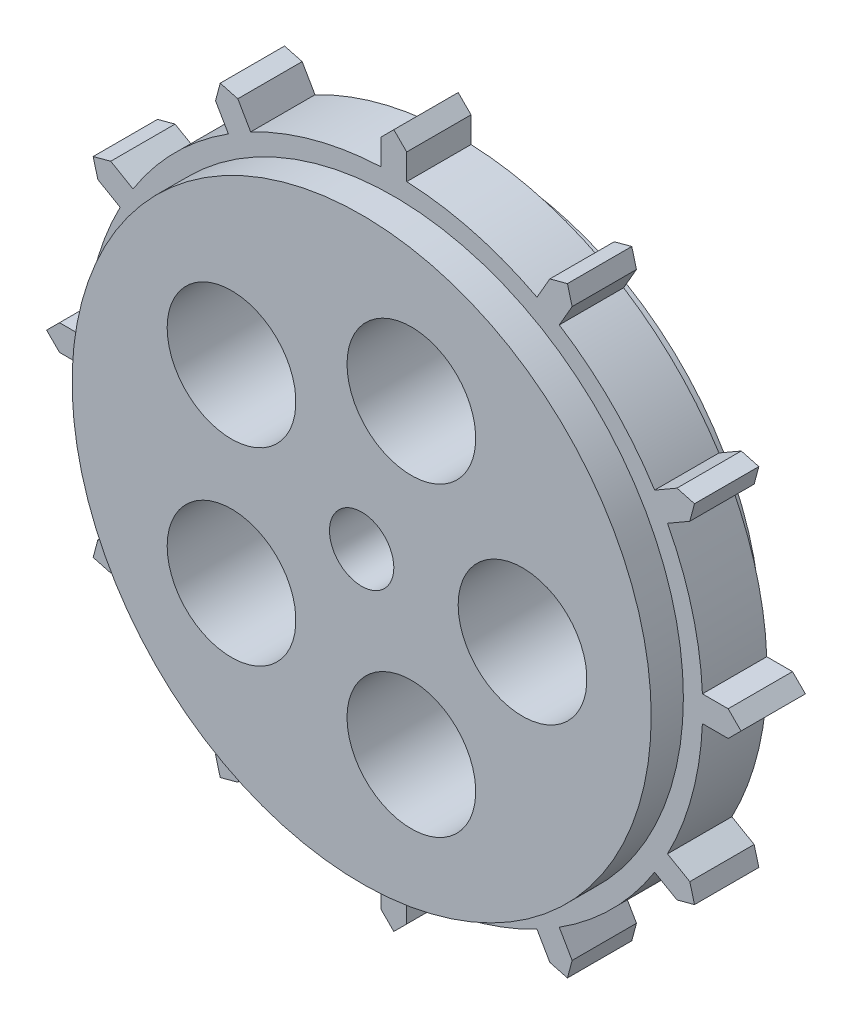
from build123d import *

# Parameters (mm, degrees)
BOSS_EXTRUDE1_DEPTH      = 2.5
BOSS_EXTRUDE1_DEPTH_BACK = 2.5
SKETCH3_R                = 21
BOSS_EXTRUDE2_DEPTH      = 2.5
SKETCH4_R                = 22.5
BOSS_EXTRUDE3_DEPTH      = 2.5
SKETCH5_R                = 2.5
CUT_EXTRUDE1_DEPTH       = 50
SKETCH6_R                = 5
CUT_EXTRUDE2_DEPTH       = 10


with BuildPart() as part:
    # Sketch1 → Boss-Extrude1 (new, two sides: drawn at the far end of the back side and taken through both)
    with BuildSketch(Plane.XY.offset(-BOSS_EXTRUDE1_DEPTH_BACK)):
        with BuildLine():
            Line((-1, 25.979157617), (-1, 23.979157617))
            ThreePointArc((-1, 23.979157617), (-6.211657082, 23.182219831), (-11.123553404, 21.266559657))
            Line((-11.123553404, 21.266559657), (-12.123553404, 22.998610465))
            Line((-12.123553404, 22.998610465), (-13.489578808, 23.364635869))
            Line((-13.489578808, 23.364635869), (-13.855604212, 21.998610465))
            Line((-13.855604212, 21.998610465), (-12.855604212, 20.266559657))
            ThreePointArc((-12.855604212, 20.266559657), (-16.970562748, 16.970562748), (-20.266559657, 12.855604212))
            Line((-20.266559657, 12.855604212), (-21.998610465, 13.855604212))
            Line((-21.998610465, 13.855604212), (-23.364635869, 13.489578808))
            Line((-23.364635869, 13.489578808), (-22.998610465, 12.123553404))
            Line((-22.998610465, 12.123553404), (-21.266559657, 11.123553404))
            ThreePointArc((-21.266559657, 11.123553404), (-23.182219831, 6.211657082), (-23.979157617, 1))
            Line((-23.979157617, 1), (-25.979157617, 1))
            Line((-25.979157617, 1), (-26.979157617, 0))
            Line((-26.979157617, 0), (-25.979157617, -1))
            Line((-25.979157617, -1), (-23.979157617, -1))
            ThreePointArc((-23.979157617, -1), (-23.182219831, -6.211657082), (-21.266559657, -11.123553405))
            Line((-21.266559657, -11.123553404), (-22.998610465, -12.123553404))
            Line((-22.998610465, -12.123553404), (-23.364635869, -13.489578808))
            Line((-23.364635869, -13.489578808), (-21.998610465, -13.855604212))
            Line((-21.998610465, -13.855604212), (-20.266559657, -12.855604212))
            ThreePointArc((-20.266559657, -12.855604212), (-16.970562748, -16.970562748), (-12.855604212, -20.266559657))
            Line((-12.855604212, -20.266559657), (-13.855604212, -21.998610465))
            Line((-13.855604212, -21.998610465), (-13.489578808, -23.364635869))
            Line((-13.489578808, -23.364635869), (-12.123553404, -22.998610465))
            Line((-12.123553404, -22.998610465), (-11.123553404, -21.266559657))
            ThreePointArc((-11.123553404, -21.266559657), (-6.211657082, -23.182219831), (-1, -23.979157617))
            Line((-1, -23.979157617), (-1, -25.979157617))
            Line((-1, -25.979157617), (0, -26.979157617))
            Line((0, -26.979157617), (1, -25.979157617))
            Line((1, -25.979157617), (1, -23.979157617))
            ThreePointArc((1, -23.979157617), (6.211657082, -23.182219831), (11.123553405, -21.266559657))
            Line((11.123553405, -21.266559657), (12.123553405, -22.998610465))
            Line((12.123553405, -22.998610465), (13.489578808, -23.364635869))
            Line((13.489578808, -23.364635869), (13.855604212, -21.998610465))
            Line((13.855604212, -21.998610465), (12.855604212, -20.266559657))
            ThreePointArc((12.855604212, -20.266559657), (16.970562748, -16.970562748), (20.266559657, -12.855604212))
            Line((20.266559657, -12.855604212), (21.998610465, -13.855604212))
            Line((21.998610465, -13.855604212), (23.364635869, -13.489578808))
            Line((23.364635869, -13.489578808), (22.998610465, -12.123553404))
            Line((22.998610465, -12.123553404), (21.266559657, -11.123553404))
            ThreePointArc((21.266559657, -11.123553404), (23.182219831, -6.211657082), (23.979157617, -1))
            Line((23.979157617, -1), (25.979157617, -1))
            Line((25.979157617, -1), (26.979157617, 0))
            Line((26.979157617, 0), (25.979157617, 1))
            Line((25.979157617, 1), (23.979157617, 1))
            ThreePointArc((23.979157617, 1), (23.182219831, 6.211657082), (21.266559657, 11.123553404))
            Line((21.266559657, 11.123553405), (22.998610465, 12.123553405))
            Line((22.998610465, 12.123553405), (23.364635869, 13.489578808))
            Line((23.364635869, 13.489578808), (21.998610465, 13.855604212))
            Line((21.998610465, 13.855604212), (20.266559657, 12.855604212))
            ThreePointArc((20.266559657, 12.855604212), (16.970562748, 16.970562748), (12.855604212, 20.266559657))
            Line((12.855604212, 20.266559657), (13.855604212, 21.998610465))
            Line((13.855604212, 21.998610465), (13.489578808, 23.364635869))
            Line((13.489578808, 23.364635869), (12.123553404, 22.998610465))
            Line((12.123553404, 22.998610465), (11.123553404, 21.266559657))
            ThreePointArc((11.123553404, 21.266559657), (6.211657082, 23.182219831), (1, 23.979157617))
            Line((1, 23.979157617), (1, 25.979157617))
            Line((1, 25.979157617), (0, 26.979157617))
            Line((0, 26.979157617), (-1, 25.979157617))
        make_face()
    extrude(amount=BOSS_EXTRUDE1_DEPTH + BOSS_EXTRUDE1_DEPTH_BACK)

    # Sketch3 → Boss-Extrude2 (add)
    with BuildSketch(Plane(origin=(0, 0, -2.5), x_dir=(-1, 0, 0), z_dir=(0, 0, -1))):
        Circle(SKETCH3_R)
    extrude(amount=BOSS_EXTRUDE2_DEPTH)

    # Sketch4 → Boss-Extrude3 (add)
    with BuildSketch(Plane.XY.offset(2.5)):
        Circle(SKETCH4_R)
    extrude(amount=BOSS_EXTRUDE3_DEPTH)

    # Sketch5 → Cut-Extrude1 (cut)
    with BuildSketch(Plane.XY.offset(5)):
        Circle(SKETCH5_R)
    extrude(amount=-CUT_EXTRUDE1_DEPTH, mode=Mode.SUBTRACT)

    # Sketch6 → Cut-Extrude2 (cut)
    with BuildSketch(Plane(origin=(0, 0, -5), x_dir=(-1, 0, 0), z_dir=(0, 0, -1))):
        with Locations((-12.5, 0)):
            Circle(SKETCH6_R)
        with Locations((-3.86271243, 11.888206454)):
            Circle(SKETCH6_R)
        with Locations((10.11271243, 7.347315654)):
            Circle(SKETCH6_R)
        with Locations((10.11271243, -7.347315654)):
            Circle(SKETCH6_R)
        with Locations((-3.86271243, -11.888206454)):
            Circle(SKETCH6_R)
    extrude(amount=-CUT_EXTRUDE2_DEPTH, mode=Mode.SUBTRACT)


solid = part.part
